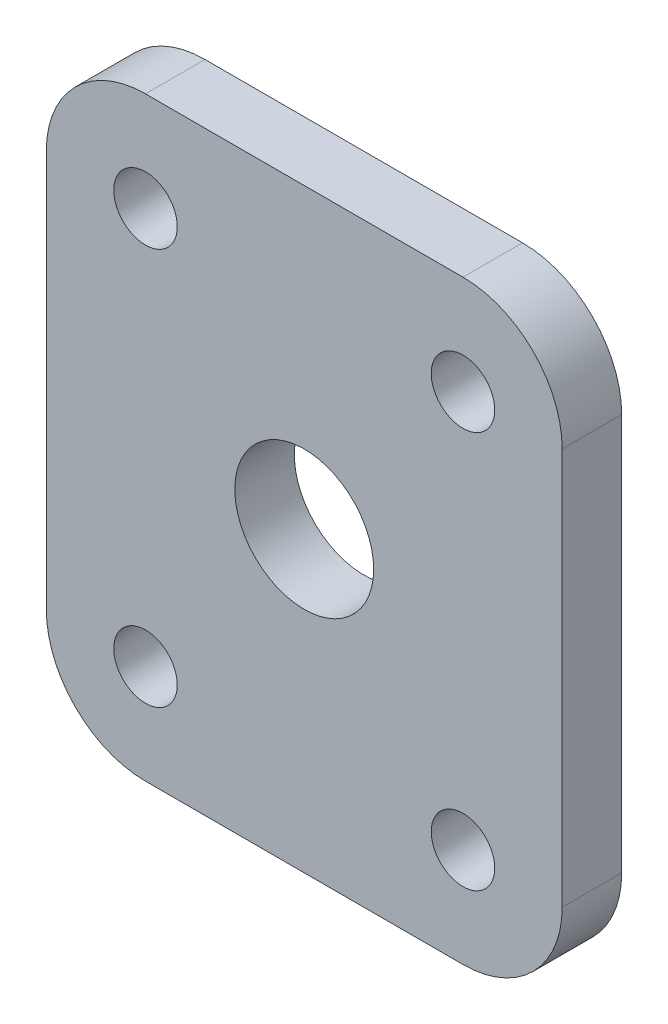
from build123d import *

# Parameters (mm, degrees)
ESBO_O1_W                = 26
ESBO_O1_H                = 30
ESBO_O1_R                = 1.6
ESBO_O1_R_2              = 3.5
RESSALTO_EXTRUS_O1_DEPTH = 3
FILETE1_R                = 5


with BuildPart() as part:
    # Esboço1 → Ressalto-extrusão1 (new body)
    with BuildSketch(Plane.XY):
        Rectangle(ESBO_O1_W, ESBO_O1_H)
        with Locations((-8, -10)):
            Circle(ESBO_O1_R, mode=Mode.SUBTRACT)
        with Locations((8, -10)):
            Circle(ESBO_O1_R, mode=Mode.SUBTRACT)
        Circle(ESBO_O1_R_2, mode=Mode.SUBTRACT)
        with Locations((-8, 10)):
            Circle(ESBO_O1_R, mode=Mode.SUBTRACT)
        with Locations((8, 10)):
            Circle(ESBO_O1_R, mode=Mode.SUBTRACT)
    extrude(amount=RESSALTO_EXTRUS_O1_DEPTH)

    # Filete1
    filete1_edges = [part.edges().sort_by_distance(p)[0] for p in [
        (-13, -15, 1.5),
        (13, -15, 1.5),
        (-13, 15, 1.5),
        (13, 15, 1.5),
    ]]
    fillet(filete1_edges, radius=FILETE1_R)


solid = part.part
